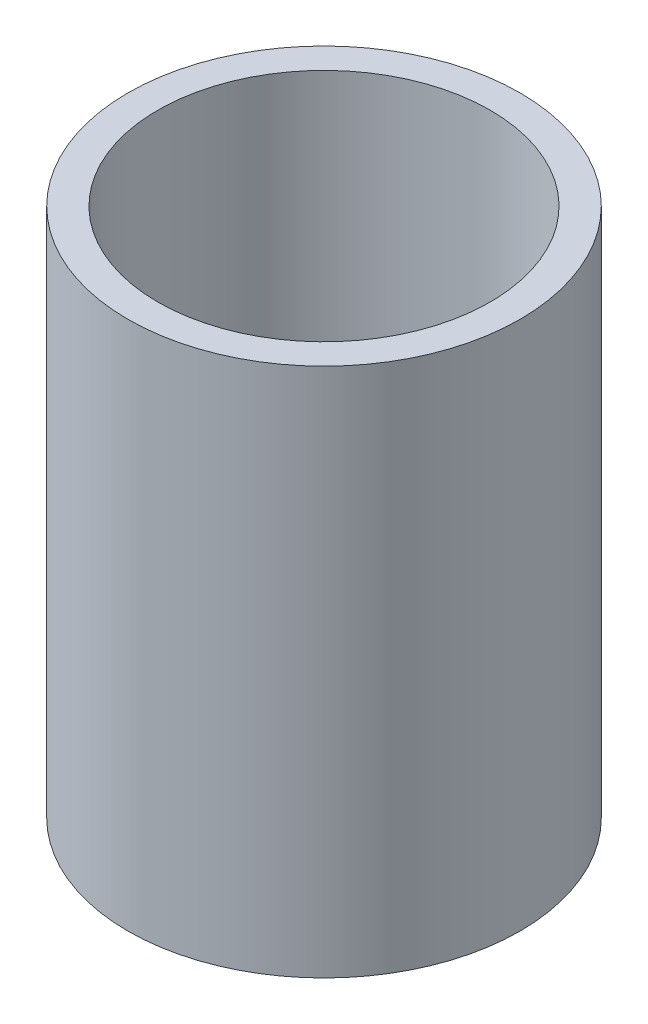
from build123d import *

# Parameters (mm, degrees)
SKETCH1_R           = 35
BOSS_EXTRUDE1_DEPTH = 94.575108356
SKETCH2_R           = 29.668203226
CUT_EXTRUDE1_DEPTH  = 107.744794348


with BuildPart() as part:
    # Sketch1 → Boss-Extrude1 (new body)
    with BuildSketch(Plane(origin=(0, 0, 0), x_dir=(1, 0, 0), z_dir=(0, 1, 0))):
        Circle(SKETCH1_R)
    extrude(amount=BOSS_EXTRUDE1_DEPTH)

    # Sketch2 → Cut-Extrude1 (cut, through all)
    with BuildSketch(Plane(origin=(0, 0, 0), x_dir=(1, 0, 0), z_dir=(0, 1, 0))):
        Circle(SKETCH2_R)
    extrude(amount=CUT_EXTRUDE1_DEPTH, mode=Mode.SUBTRACT)


solid = part.part
